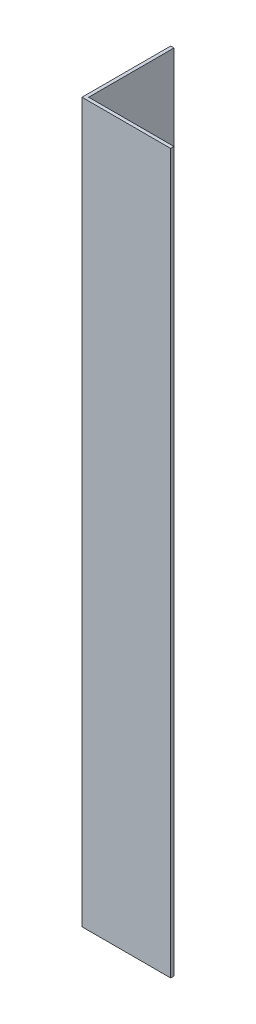
from build123d import *

# Parameters (mm, degrees)
EXTRUDE_1_DEPTH = 162


with BuildPart() as part:
    # Эскиз1 → Бобышка-Вытянуть1 (new body)
    with BuildSketch(Plane(origin=(0, 0, 0), x_dir=(1, 0, 0), z_dir=(0, 1, 0))):
        Polygon((0, 0), (0, 20), (0.75, 20), (0.75, 0.75), (20, 0.75), (20, 0), align=None)
    extrude(amount=EXTRUDE_1_DEPTH)


solid = part.part
